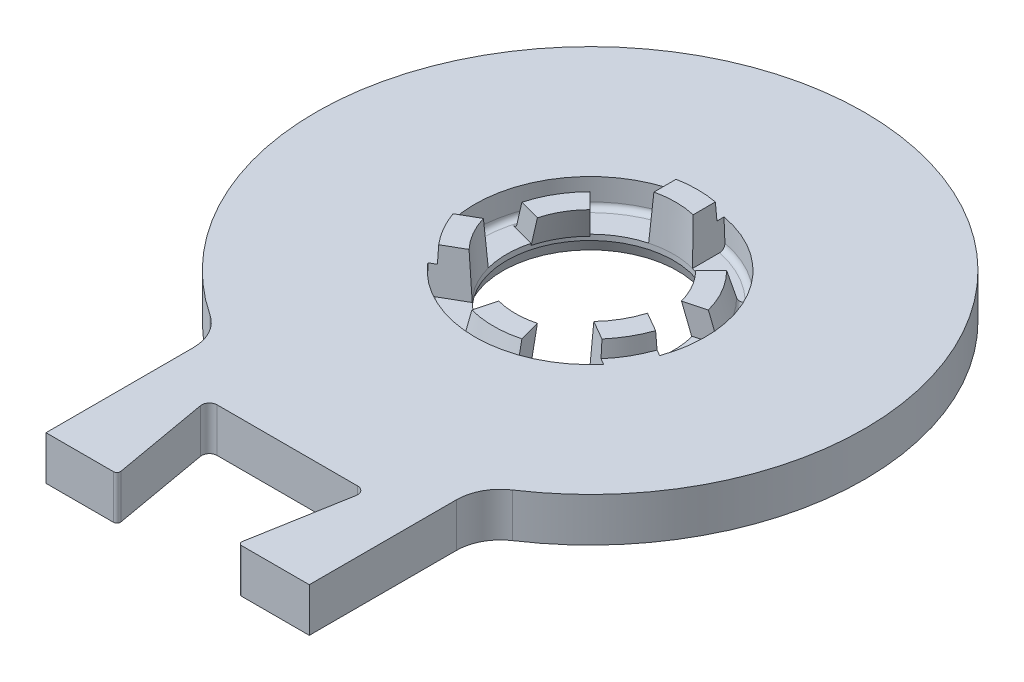
from build123d import *

# Parameters (mm, degrees)
SKETCH1_R                = 4
BOSS_EXTRUDE1_DEPTH      = 2
SKETCH2_R                = 12.5
SKETCH2_R_2              = 3.8
BOSS_EXTRUDE2_DEPTH      = 2
SKETCH4_W                = 12
SKETCH4_H                = 0.2
CUT_EXTRUDE1_DEPTH       = 4
FILLET3_R                = 0.35
FILLET4_R                = 0.15
FILLET6_R                = 2
SKETCH13_R               = 5.25
CUT_EXTRUDE5_DEPTH       = 1.25
REVOLVE2_ANGLE           = 30
CIRPATTERN2_COUNT        = 3
CHAMFER1_SIZE            = 0.5
CHAMFER1_SIZE2           = 0.181985117
FILLET14_R               = 0.25
BOSS_EXTRUDE8_DEPTH      = 2
BOSS_EXTRUDE8_DRAFT      = -3
SKETCH16_W               = 2
SKETCH16_H               = 1.934959958
BOSS_EXTRUDE9_DEPTH      = 1.25
BOSS_EXTRUDE9_TAPER      = 3
CIRPATTERN3_COUNT        = 3
CIRPATTERN3_COPY_1_DEPTH = 2
CIRPATTERN3_COPY_1_DRAFT = -3
CIRPATTERN3_COPY_2_DEPTH = 2
CIRPATTERN3_COPY_2_DRAFT = -3


with BuildPart() as part:
    # Sketch1 → Boss-Extrude1 (new body)
    with BuildSketch(Plane(origin=(0, 0, 0), x_dir=(1, 0, 0), z_dir=(0, 1, 0))):
        Polygon((-6, 6), (-6, -13.291502622), (-6, -19), (-2.70227506, -19), (-3.619175359, -13.8), (0, -13.8), (3.619175359, -13.8), (2.70227506, -19), (6, -19), (6, -13.291502622), (6, 6), align=None)
        with Locations(Location((0, 0, 0), (0, 0, 270))):
            Circle(SKETCH1_R, mode=Mode.SUBTRACT)
    extrude(amount=BOSS_EXTRUDE1_DEPTH)

    # Sketch2 → Boss-Extrude2 (add)
    with BuildSketch(Plane(origin=(0, 0, 0), x_dir=(1, 0, 0), z_dir=(0, 1, 0))):
        Circle(SKETCH2_R)
        with Locations(Location((0, 0, 0), (0, 0, 270))):
            Circle(SKETCH2_R_2, mode=Mode.SUBTRACT)
    extrude(amount=BOSS_EXTRUDE2_DEPTH)

    # Sketch4 → Cut-Extrude1 (cut)
    with BuildSketch(Plane(origin=(0, 2, 0), x_dir=(1, 0, 0), z_dir=(0, 1, 0))):
        with Locations((0, -18.9)):
            Rectangle(SKETCH4_W, SKETCH4_H)
    extrude(amount=-CUT_EXTRUDE1_DEPTH, mode=Mode.SUBTRACT)

    # Fillet3
    fillet3_edges = [part.edges().sort_by_distance(p)[0] for p in [
        (3.619175359, 1, 13.8),
        (-3.619175359, 1, 13.8),
    ]]
    fillet(fillet3_edges, radius=FILLET3_R)

    # Fillet4
    fillet4_edges = [part.edges().sort_by_distance(p)[0] for p in [
        (2.737540456, 1, 18.8),
        (-2.737540456, 1, 18.8),
    ]]
    fillet(fillet4_edges, radius=FILLET4_R)

    # Fillet6
    fillet6_edges = [part.edges().sort_by_distance(p)[0] for p in [
        (6, 1, 10.9658561),
        (-6, 1, 10.9658561),
    ]]
    fillet(fillet6_edges, radius=FILLET6_R)

    # Sketch13 → Cut-Extrude5 (cut)
    with BuildSketch(Plane(origin=(0, 2, 0), x_dir=(1, 0, 0), z_dir=(0, 1, 0))):
        with Locations(Location((0, 0, 0), (0, 0, 270))):
            Circle(SKETCH13_R)
    extrude(amount=-CUT_EXTRUDE5_DEPTH, mode=Mode.SUBTRACT)

    # Sketch12 → Revolve2 (revolve, symmetric)
    with BuildSketch(Plane(origin=(0, 0, 0), x_dir=(0, 0, -1), z_dir=(1, 0, 0))) as revolve2_sk:
        Polygon((-4, 0), (-3.4, 2), (-4.4, 2), (-5, 0), align=None)
    revolve2 = revolve(axis=Axis((0, 0, 0), (0, 1, 0)), revolution_arc=REVOLVE2_ANGLE / 2)
    revolve2 = revolve2 + revolve(revolve2_sk.sketch, axis=Axis((0, 0, 0), (0, -1, 0)), revolution_arc=REVOLVE2_ANGLE / 2)

    # CirPattern2: Revolve2 ×3 about axis
    cirpattern2_axis = Axis((0, 0, 0), (0, 1, 0))
    for i in range(1, CIRPATTERN2_COUNT):
        add(revolve2.rotate(cirpattern2_axis, i * 360 / CIRPATTERN2_COUNT))

    # Chamfer1
    chamfer1_edges = [part.edges().sort_by_distance(p)[0] for p in [
        (0, 0, -3.8),
    ]]
    chamfer1_side = [part.faces().sort_by_distance(p)[0] for p in [
        (0, 0.375, -3.8),
    ]]
    chamfer(chamfer1_edges, length=CHAMFER1_SIZE, length2=CHAMFER1_SIZE2, reference=chamfer1_side[0])

    # Fillet14
    fillet14_edges = [part.edges().sort_by_distance(p)[0] for p in [
        (0, 0.75, -5.25),
        (0, 0.75, 4.775),
        (-4.135271303, 0.75, -2.3875),
        (4.135271303, 0.75, -2.3875),
    ]]
    fillet(fillet14_edges, radius=FILLET14_R)


with BuildPart() as boss_extrude8_tool:
    # Boss-Extrude8: read off the stored shape, not the designer's step
    # Boss-Extrude8 outline → Boss-Extrude8 (with draft: the straight prism first)
    with BuildSketch(Plane.XZ.offset(-2.75)):
        with BuildLine():
            Line((-0.895184441, -3.800819565), (-0.895184441, -4.812637066))
            ThreePointArc((-0.895184441, -4.812637066), (0, -4.895184441), (0.895184441, -4.812637066))
            Line((0.895184441, -4.812637066), (0.895184441, -3.800819565))
            ThreePointArc((0.895184441, -3.800819565), (0, -3.904815559), (-0.895184441, -3.800819565))
        make_face()
    extrude(amount=BOSS_EXTRUDE8_DEPTH)
    # Boss-Extrude8: the draft: its side faces are tilted about the plane it starts from
    boss_extrude8_sides = [boss_extrude8_tool.faces().sort_by_distance(p)[0] for p in [
        (0.895184441, 1.75, -4.306728316),
        (0, 1.75, -3.904815559),
        (-0.895184441, 1.75, -4.306728316),
        (0, 1.75, -4.895184441),
    ]]
    draft(boss_extrude8_sides, Plane.XZ.offset(-2.75), BOSS_EXTRUDE8_DRAFT)


with BuildPart() as part_1:
    add(part.part)

    # Boss-Extrude8: add boss_extrude8_tool
    add(boss_extrude8_tool.part)

    # Sketch16 → Boss-Extrude9 (add)
    with BuildSketch(Plane(origin=(0, 0.75, 0), x_dir=(1, 0, 0), z_dir=(0, 1, 0))):
        with Locations((0, 5.25)):
            Rectangle(SKETCH16_W, SKETCH16_H)
    boss_extrude9 = extrude(amount=BOSS_EXTRUDE9_DEPTH, taper=BOSS_EXTRUDE9_TAPER)

    # CirPattern3: Boss-Extrude9 ×3 about axis
    cirpattern3_axis = Axis((0, 0, 0), (0, 1, 0))
    for i in range(1, CIRPATTERN3_COUNT):
        add(boss_extrude9.rotate(cirpattern3_axis, i * 360 / CIRPATTERN3_COUNT))


with BuildPart() as cirpattern3_copy_1_tool:
    # CirPattern3 copy 1 sketch → CirPattern3 copy 1 (with draft: the straight prism first)
    with BuildSketch(Plane(origin=(0, 2.75, 0), x_dir=(-0.4999999999999998, 0, -0.8660254037844387), z_dir=(0, -1, 0))):
        with BuildLine():
            Line((-0.895184441, -3.800819565), (-0.895184441, -4.812637066))
            ThreePointArc((-0.895184441, -4.812637066), (0, -4.895184441), (0.895184441, -4.812637066))
            Line((0.895184441, -4.812637066), (0.895184441, -3.800819565))
            ThreePointArc((0.895184441, -3.800819565), (0, -3.904815559), (-0.895184441, -3.800819565))
        make_face()
    extrude(amount=CIRPATTERN3_COPY_1_DEPTH)
    # CirPattern3 copy 1: the draft: its side faces are tilted about the plane it starts from
    cirpattern3_copy_1_sides = [cirpattern3_copy_1_tool.faces().sort_by_distance(p)[0] for p in [
        (-4.177328349, 1.75, 1.378111691),
        (-3.381669471, 1.75, 1.952407779),
        (-3.282143908, 1.75, 2.928616625),
        (-4.239354082, 1.75, 2.44759222),
    ]]
    draft(cirpattern3_copy_1_sides, Plane(origin=(0, 2.75, 0), x_dir=(-0.4999999999999998, 0, -0.8660254037844387), z_dir=(0, -1, 0)), CIRPATTERN3_COPY_1_DRAFT)


with BuildPart() as part_2:
    add(part_1.part)

    # CirPattern3 copy 1: add cirpattern3_copy_1_tool
    add(cirpattern3_copy_1_tool.part)


with BuildPart() as cirpattern3_copy_2_tool:
    # CirPattern3 copy 2 sketch → CirPattern3 copy 2 (with draft: the straight prism first)
    with BuildSketch(Plane(origin=(0, 2.75, 0), x_dir=(-0.5000000000000004, 0, 0.8660254037844384), z_dir=(0, -1, 0))):
        with BuildLine():
            Line((-0.895184441, -3.800819565), (-0.895184441, -4.812637066))
            ThreePointArc((-0.895184441, -4.812637066), (0, -4.895184441), (0.895184441, -4.812637066))
            Line((0.895184441, -4.812637066), (0.895184441, -3.800819565))
            ThreePointArc((0.895184441, -3.800819565), (0, -3.904815559), (-0.895184441, -3.800819565))
        make_face()
    extrude(amount=CIRPATTERN3_COPY_2_DEPTH)
    # CirPattern3 copy 2: the draft: its side faces are tilted about the plane it starts from
    cirpattern3_copy_2_sides = [cirpattern3_copy_2_tool.faces().sort_by_distance(p)[0] for p in [
        (3.282143908, 1.75, 2.928616625),
        (3.381669471, 1.75, 1.95240778),
        (4.177328349, 1.75, 1.378111691),
        (4.239354082, 1.75, 2.447592221),
    ]]
    draft(cirpattern3_copy_2_sides, Plane(origin=(0, 2.75, 0), x_dir=(-0.5000000000000004, 0, 0.8660254037844384), z_dir=(0, -1, 0)), CIRPATTERN3_COPY_2_DRAFT)


with BuildPart() as part_3:
    add(part_2.part)

    # CirPattern3 copy 2: add cirpattern3_copy_2_tool
    add(cirpattern3_copy_2_tool.part)


solid = part_3.part
